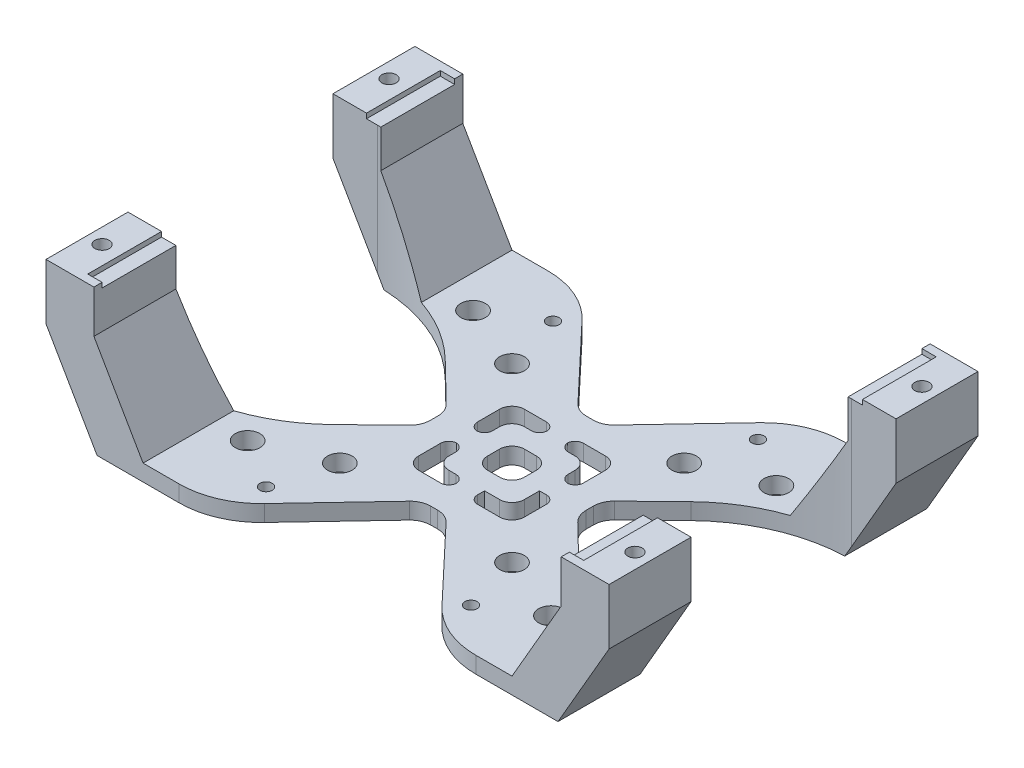
from build123d import *

# Parameters (mm, degrees)
SKETCH_1_R               = 3
SKETCH_1_R_2             = 1.5
SKETCH_1_W               = 8.959374782
SKETCH_1_H               = 8.959374782
EXTRUDE_1_DEPTH          = 4
FILLET_6_R               = 3
FILLET_7_R               = 3
FILLET_8_R               = 2
EXTRUDE_START            = -4
SKETCH_5_W               = 5
SKETCH_5_H               = 20
EXTRUDE_3_DEPTH          = 4
SKETCH_6_W               = 5
SKETCH_6_H               = 20
EXTRUDE_4_DEPTH          = 30
EXTRUDE_5_DEPTH          = 1.2
EXTRUDE_6_DEPTH          = 20
EXTRUDE_7_DEPTH          = 20
SKETCH_11_R              = 1.75
CUT_EXTRUDE_1_DEPTH      = 15
EXTRUDE_START_2          = -90
EXTRUDE_9_DEPTH          = 90
CUT_EXTRUDE_2_DEPTH      = 119.561322103
CUT_EXTRUDE_2_DEPTH_BACK = 119.561322103
CUT_EXTRUDE_4_DEPTH      = 88.841830006
CUT_EXTRUDE_4_DEPTH_BACK = 88.841830006


with BuildPart() as part:
    # Эскиз1 → Бобышка-Вытянуть1 (new body)
    with BuildSketch(Plane(origin=(0, 0, 0), x_dir=(1, 0, 0), z_dir=(0, 1, 0))):
        with BuildLine():
            ThreePointArc((20.512341433, -4.472193639), (19.393575528, -2.833865794), (19, -0.889424079))
            Line((19, -0.889424079), (19, 0.889424079))
            ThreePointArc((19, 0.889424079), (19.393575528, 2.833865794), (20.512341433, 4.472193639))
            Line((20.512341433, 4.472193639), (40.487658567, 23.91723044))
            ThreePointArc((40.487658567, 23.91723044), (41.971578686, 28.032358305), (39.6499947, 31.73999152))
            Line((39.6499947, 31.73999152), (27.6499947, 39.23999152))
            ThreePointArc((27.6499947, 39.23999152), (24.364097834, 39.959397991), (21.366001739, 38.434247609))
            Line((21.366001739, 38.434247609), (4.479687391, 20.565752391))
            ThreePointArc((4.479687391, 20.565752391), (2.824168591, 19.408092006), (0.84568913, 19))
            Line((0.84568913, 19), (-0.84568913, 19))
            ThreePointArc((-0.84568913, 19), (-2.824168591, 19.408092006), (-4.479687391, 20.565752391))
            Line((-4.479687391, 20.565752391), (-21.366001739, 38.434247609))
            ThreePointArc((-21.366001739, 38.434247609), (-24.364097834, 39.959397991), (-27.6499947, 39.23999152))
            Line((-27.6499947, 39.23999152), (-39.6499947, 31.73999152))
            ThreePointArc((-39.6499947, 31.73999152), (-41.971578686, 28.032358305), (-40.487658567, 23.91723044))
            Line((-40.487658567, 23.91723044), (-20.512341433, 4.472193639))
            ThreePointArc((-20.512341433, 4.472193639), (-19.393575528, 2.833865794), (-19, 0.889424079))
            Line((-19, 0.889424079), (-19, -0.889424079))
            ThreePointArc((-19, -0.889424079), (-19.393575528, -2.833865794), (-20.512341433, -4.472193639))
            Line((-20.512341433, -4.472193639), (-40.487658567, -23.91723044))
            ThreePointArc((-40.487658567, -23.91723044), (-41.971578686, -28.032358305), (-39.6499947, -31.73999152))
            Line((-39.6499947, -31.73999152), (-27.6499947, -39.23999152))
            ThreePointArc((-27.6499947, -39.23999152), (-24.364097834, -39.959397991), (-21.366001739, -38.434247609))
            Line((-21.366001739, -38.434247609), (-4.479687391, -20.565752391))
            ThreePointArc((-4.479687391, -20.565752391), (-2.824168591, -19.408092006), (-0.84568913, -19))
            Line((-0.84568913, -19), (0.84568913, -19))
            ThreePointArc((0.84568913, -19), (2.824168591, -19.408092006), (4.479687391, -20.565752391))
            Line((4.479687391, -20.565752391), (21.366001739, -38.434247609))
            ThreePointArc((21.366001739, -38.434247609), (24.364097834, -39.959397991), (27.6499947, -39.23999152))
            Line((27.6499947, -39.23999152), (39.6499947, -31.73999152))
            ThreePointArc((39.6499947, -31.73999152), (41.971578686, -28.032358305), (40.487658567, -23.91723044))
            Line((40.487658567, -23.91723044), (20.512341433, -4.472193639))
        make_face()
        Polygon((-12.905970183, 12.905970183), (-2.5, 12.905970183), (-2.5, 9.203534757), (-9.203534757, 9.203534757), (-9.203534757, 2.5), (-12.905970183, 2.5), align=None, mode=Mode.SUBTRACT)
        Polygon((-9.203534757, -2.5), (-9.203534757, -9.203534757), (-2.5, -9.203534757), (-2.5, -12.905970183), (-12.905970183, -12.905970183), (-12.905970183, -2.5), align=None, mode=Mode.SUBTRACT)
        Polygon((2.5, -9.203534757), (9.203534757, -9.203534757), (9.203534757, -2.5), (12.905970183, -2.5), (12.905970183, -12.905970183), (2.5, -12.905970183), align=None, mode=Mode.SUBTRACT)
        Polygon((9.203534757, 2.5), (9.203534757, 9.203534757), (2.5, 9.203534757), (2.5, 12.905970183), (12.905970183, 12.905970183), (12.905970183, 2.5), align=None, mode=Mode.SUBTRACT)
        with Locations(Location((37, -27.5, 0), (0, 0, 270))):
            Circle(SKETCH_1_R, mode=Mode.SUBTRACT)
        with Locations(Location((37, 27.5, 0), (0, 0, 270))):
            Circle(SKETCH_1_R, mode=Mode.SUBTRACT)
        with Locations(Location((25, -35, 0), (0, 0, 270))):
            Circle(SKETCH_1_R_2, mode=Mode.SUBTRACT)
        with Locations(Location((25, 35, 0), (0, 0, 270))):
            Circle(SKETCH_1_R_2, mode=Mode.SUBTRACT)
        with Locations(Location((-25, -35, 0), (0, 0, 270))):
            Circle(SKETCH_1_R_2, mode=Mode.SUBTRACT)
        with Locations(Location((-25, 35, 0), (0, 0, 270))):
            Circle(SKETCH_1_R_2, mode=Mode.SUBTRACT)
        with Locations(Location((-37, -27.5, 0), (0, 0, 270))):
            Circle(SKETCH_1_R, mode=Mode.SUBTRACT)
        with Locations(Location((-37, 27.5, 0), (0, 0, 270))):
            Circle(SKETCH_1_R, mode=Mode.SUBTRACT)
        Rectangle(SKETCH_1_W, SKETCH_1_H, mode=Mode.SUBTRACT)
        with Locations(Location((21, 21, 0), (0, 0, 270))):
            Circle(SKETCH_1_R, mode=Mode.SUBTRACT)
        with Locations(Location((21, -21, 0), (0, 0, 270))):
            Circle(SKETCH_1_R, mode=Mode.SUBTRACT)
        with Locations(Location((-21, -21, 0), (0, 0, 270))):
            Circle(SKETCH_1_R, mode=Mode.SUBTRACT)
        with Locations(Location((-21, 21, 0), (0, 0, 270))):
            Circle(SKETCH_1_R, mode=Mode.SUBTRACT)
    extrude(amount=EXTRUDE_1_DEPTH)

    # Скругление6
    fillet_6_edges = [part.edges().sort_by_distance(p)[0] for p in [
        (4.479687391, 2, 4.479687391),
        (4.479687391, 2, -4.479687391),
        (-4.479687391, 2, -4.479687391),
        (-4.479687391, 2, 4.479687391),
    ]]
    fillet(fillet_6_edges, radius=FILLET_6_R)

    # Скругление7
    fillet_7_edges = [part.edges().sort_by_distance(p)[0] for p in [
        (12.905970183, 2, -12.905970183),
        (-12.905970183, 2, -12.905970183),
        (-12.905970183, 2, 12.905970183),
        (12.905970183, 2, 12.905970183),
        (-9.203534757, 2, -9.203534757),
        (-9.203534757, 2, 9.203534757),
        (9.203534757, 2, 9.203534757),
        (9.203534757, 2, -9.203534757),
    ]]
    fillet(fillet_7_edges, radius=FILLET_7_R)

    # Скругление8
    # the kernel refuses this fillet: 2 mm, written as the material it adds along each edge
    with BuildSketch(Plane(origin=(-2.5, 0, 12.905970183), x_dir=(0, 0, -1), z_dir=(0, 1, 0)), Plane(origin=(-2.5, 0, 9.203534757), x_dir=(-1, 0, 0), z_dir=(0, 1, 0)), Plane(origin=(12.905970183, 0, 2.5), x_dir=(-1, 0, 0), z_dir=(0, 1, 0)), Plane(origin=(2.5, 0, -9.203534757), x_dir=(1, 0, 0), z_dir=(0, 1, 0)), Plane(origin=(2.5, 0, -12.905970183), x_dir=(0, 0, 1), z_dir=(0, 1, 0)), Plane(origin=(-2.5, 0, -12.905970183), x_dir=(-1, 0, 0), z_dir=(0, 1, 0)), Plane(origin=(-2.5, 0, -9.203534757), x_dir=(0, 0, -1), z_dir=(0, 1, 0))) as fillet_8_piece_1:
        with BuildLine():
            CenterArc((FILLET_8_R, FILLET_8_R), FILLET_8_R, 180, 90)
            Line((0, FILLET_8_R), (0, 0))
            Line((0, 0), (FILLET_8_R, 0))
        make_face()
    extrude(amount=4)
    with BuildSketch(Plane(origin=(12.905970183, 0, -2.5), x_dir=(-1, 0, 0), z_dir=(0, 1, 0)), Plane(origin=(2.5, 0, 12.905970183), x_dir=(0, 0, -1), z_dir=(0, 1, 0)), Plane(origin=(9.203534757, 0, -2.5), x_dir=(0, 0, -1), z_dir=(0, 1, 0)), Plane(origin=(-9.203534757, 0, -2.5), x_dir=(-1, 0, 0), z_dir=(0, 1, 0)), Plane(origin=(-12.905970183, 0, -2.5), x_dir=(0, 0, -1), z_dir=(0, 1, 0)), Plane(origin=(-9.203534757, 0, 2.5), x_dir=(0, 0, 1), z_dir=(0, 1, 0)), Plane(origin=(-12.905970183, 0, 2.5), x_dir=(1, 0, 0), z_dir=(0, 1, 0))) as fillet_8_piece_2:
        with BuildLine():
            CenterArc((FILLET_8_R, -FILLET_8_R), FILLET_8_R, 90, 90)
            Line((0, -FILLET_8_R), (0, 0))
            Line((0, 0), (FILLET_8_R, 0))
        make_face()
    extrude(amount=4)

    # Эскиз5 → Бобышка-Вытянуть3 (add)
    with BuildSketch(Plane(origin=(0, 4, 0), x_dir=(1, 0, 0), z_dir=(0, 1, 0)).offset(EXTRUDE_START)):
        with BuildLine():
            ThreePointArc((-27.6499947, 39.23999152), (-24.364097834, 39.959397991), (-21.366001739, 38.434247609))
            Line((-21.366001739, 38.434247609), (-21.652103645, 38.736990435))
            ThreePointArc((-21.652103645, 38.736990435), (-28.274178845, 43.367631975), (-36.188096689, 45))
            Line((-36.188096689, 45), (-60, 45))
            Line((-60, 45), (-60, 25))
            Line((-60, 25), (-57.854189798, 25))
            ThreePointArc((-57.854189798, 25), (-42.795741324, 22.057295227), (-29.952921259, 13.662156477))
            Line((-29.952921259, 13.662156477), (-40.487658567, 23.91723044))
            ThreePointArc((-40.487658567, 23.91723044), (-41.971578686, 28.032358305), (-39.6499947, 31.73999152))
            Line((-39.6499947, 31.73999152), (-27.6499947, 39.23999152))
        make_face()
        with Locations((-62.5, 35)):
            Rectangle(SKETCH_5_W, SKETCH_5_H)
        with BuildLine():
            Line((-21.652103645, -38.736990435), (-21.366001739, -38.434247609))
            ThreePointArc((-21.366001739, -38.434247609), (-24.364097834, -39.959397991), (-27.6499947, -39.23999152))
            Line((-27.6499947, -39.23999152), (-39.6499947, -31.73999152))
            ThreePointArc((-39.6499947, -31.73999152), (-41.971578686, -28.032358305), (-40.487658567, -23.91723044))
            Line((-40.487658567, -23.91723044), (-29.952921259, -13.662156477))
            ThreePointArc((-29.952921259, -13.662156477), (-42.795741324, -22.057295227), (-57.854189798, -25))
            Line((-57.854189798, -25), (-60, -25))
            Line((-60, -25), (-60, -45))
            Line((-60, -45), (-36.188096689, -45))
            ThreePointArc((-36.188096689, -45), (-28.274178845, -43.367631975), (-21.652103645, -38.736990435))
        make_face()
        with Locations((-62.5, -35)):
            Rectangle(SKETCH_5_W, SKETCH_5_H)
        with BuildLine():
            ThreePointArc((57.854189798, -25), (42.795741324, -22.057295227), (29.952921259, -13.662156477))
            Line((29.952921259, -13.662156477), (40.487658567, -23.91723044))
            ThreePointArc((40.487658567, -23.91723044), (41.971578686, -28.032358305), (39.6499947, -31.73999152))
            Line((39.6499947, -31.73999152), (27.6499947, -39.23999152))
            ThreePointArc((27.6499947, -39.23999152), (24.364097834, -39.959397991), (21.366001739, -38.434247609))
            Line((21.366001739, -38.434247609), (21.652103645, -38.736990435))
            ThreePointArc((21.652103645, -38.736990435), (28.274178845, -43.367631975), (36.188096689, -45))
            Line((36.188096689, -45), (60, -45))
            Line((60, -45), (60, -25))
            Line((60, -25), (57.854189798, -25))
        make_face()
        with Locations((62.5, -35)):
            Rectangle(SKETCH_5_W, SKETCH_5_H)
        with BuildLine():
            ThreePointArc((29.952921259, 13.662156477), (42.795741324, 22.057295227), (57.854189798, 25))
            Line((57.854189798, 25), (60, 25))
            Line((60, 25), (60, 45))
            Line((60, 45), (36.188096689, 45))
            ThreePointArc((36.188096689, 45), (28.274178845, 43.367631975), (21.652103645, 38.736990435))
            Line((21.652103645, 38.736990435), (21.366001739, 38.434247609))
            ThreePointArc((21.366001739, 38.434247609), (24.364097834, 39.959397991), (27.6499947, 39.23999152))
            Line((27.6499947, 39.23999152), (39.6499947, 31.73999152))
            ThreePointArc((39.6499947, 31.73999152), (41.971578686, 28.032358305), (40.487658567, 23.91723044))
            Line((40.487658567, 23.91723044), (29.952921259, 13.662156477))
        make_face()
        with Locations((62.5, 35)):
            Rectangle(SKETCH_5_W, SKETCH_5_H)
    extrude(amount=EXTRUDE_3_DEPTH)

    # Эскиз6 → Бобышка-Вытянуть4 (add)
    with BuildSketch(Plane(origin=(0, 4, 0), x_dir=(1, 0, 0), z_dir=(0, 1, 0))):
        with BuildLine():
            Line((-57, -45), (-57, -24.990878457))
            ThreePointArc((-57, -24.990878457), (-57.427070548, -24.997719549), (-57.854189798, -25))
            Line((-57.854189798, -25), (-65, -25))
            Line((-65, -25), (-65, -45))
            Line((-65, -45), (-57, -45))
        make_face()
        with BuildLine():
            Line((-57, 24.990878457), (-57, 45))
            Line((-57, 45), (-65, 45))
            Line((-65, 45), (-65, 25))
            Line((-65, 25), (-57.854189798, 25))
            ThreePointArc((-57.854189798, 25), (-57.427070548, 24.997719549), (-57, 24.990878457))
        make_face()
        with Locations((62.5, 35)):
            Rectangle(SKETCH_6_W, SKETCH_6_H)
        with BuildLine():
            Line((60, 25), (60, 45))
            Line((60, 45), (57, 45))
            Line((57, 45), (57, 24.990878457))
            ThreePointArc((57, 24.990878457), (57.427070548, 24.997719549), (57.854189798, 25))
            Line((57.854189798, 25), (60, 25))
        make_face()
        with BuildLine():
            ThreePointArc((57.854189798, -25), (57.427070548, -24.997719549), (57, -24.990878457))
            Line((57, -24.990878457), (57, -45))
            Line((57, -45), (65, -45))
            Line((65, -45), (65, -25))
            Line((65, -25), (57.854189798, -25))
        make_face()
    extrude(amount=EXTRUDE_4_DEPTH)

    # Эскиз7 → Бобышка-Вытянуть5 (add)
    with BuildSketch(Plane(origin=(0, 34, 0), x_dir=(1, 0, 0), z_dir=(0, 1, 0))):
        Polygon((-65, 25), (-60.5, 25), (-60.5, 43), (-57, 43), (-57, 45), (-65, 45), align=None)
        Polygon((-57, -43), (-60.5, -43), (-60.5, -25), (-65, -25), (-65, -45), (-57, -45), align=None)
        Polygon((60.5, -43), (57, -43), (57, -45), (65, -45), (65, -25), (60.5, -25), align=None)
        Polygon((60.5, 43), (60.5, 25), (65, 25), (65, 45), (57, 45), (57, 43), align=None)
    extrude(amount=EXTRUDE_5_DEPTH)

    # Эскиз8 → Бобышка-Вытянуть6 (add)
    with BuildSketch(Plane(origin=(0, 0, 25), x_dir=(-1, 0, 0), z_dir=(0, 0, -1))):
        Polygon((65, 35.2), (65, 15.2), (68.68585807, 21.584093447), (68.68585807, 35.2), align=None)
    extrude_6 = extrude(amount=-EXTRUDE_6_DEPTH)

    # Зеркальное отражение1: Бобышка-Вытянуть6 across plane
    add(extrude_6.mirror(Plane(origin=(0, 0, 0), x_dir=(0, 0, 1), z_dir=(1, 0, 0))))

    # Эскиз10 → Бобышка-Вытянуть7 (add)
    with BuildSketch(Plane(origin=(0, 0, -45), x_dir=(-1, 0, 0), z_dir=(0, 0, -1))):
        Polygon((65, 35.2), (65, 15.2), (68.68585807, 21.584093447), (68.68585807, 35.2), align=None)
    extrude_7 = extrude(amount=-EXTRUDE_7_DEPTH)

    # Зеркальное отражение12: Бобышка-Вытянуть7 across plane
    add(extrude_7.mirror(Plane(origin=(0, 0, 0), x_dir=(0, 0, 1), z_dir=(1, 0, 0))))

    # Эскиз11 → Вырез-Вытянуть1 (cut)
    with BuildSketch(Plane(origin=(0, 35.2, 0), x_dir=(1, 0, 0), z_dir=(0, 1, 0))):
        with Locations(Location((65, 35, 0), (0, 0, 270))):
            Circle(SKETCH_11_R)
        with Locations(Location((-65, 35, 0), (0, 0, 270))):
            Circle(SKETCH_11_R)
        with Locations(Location((-65, -35, 0), (0, 0, 270))):
            Circle(SKETCH_11_R)
        with Locations(Location((65, -35, 0), (0, 0, 270))):
            Circle(SKETCH_11_R)
    extrude(amount=-CUT_EXTRUDE_1_DEPTH, mode=Mode.SUBTRACT)

    # Эскиз13 → Бобышка-Вытянуть9 (add)
    with BuildSketch(Plane(origin=(0, 0, -45), x_dir=(-1, 0, 0), z_dir=(0, 0, -1)).offset(EXTRUDE_START_2)):
        Polygon((-57, 24.784609691), (-57, 4), (-45, 4), align=None)
        Polygon((57, 24.784609691), (45, 4), (57, 4), align=None)
    extrude(amount=EXTRUDE_9_DEPTH)

    # Эскиз14 → Вырез-Вытянуть2 (cut, two sides: drawn at the far end of the back side and taken through both)
    with BuildSketch(Plane(origin=(0, 0, -45), x_dir=(-1, 0, 0), z_dir=(0, 0, -1)).offset(-CUT_EXTRUDE_2_DEPTH_BACK)):
        Polygon((65, 15.2), (56.224275908, 0), (65, 0), align=None)
        Polygon((-56.224275908, 0), (-65, 15.2), (-65, 0), align=None)
    extrude(amount=CUT_EXTRUDE_2_DEPTH + CUT_EXTRUDE_2_DEPTH_BACK, mode=Mode.SUBTRACT)

    # Эскиз15 → Вырез-Вытянуть4 (cut, two sides: drawn at the far end of the back side and taken through both)
    with BuildSketch(Plane(origin=(0, 4, 0), x_dir=(1, 0, 0), z_dir=(0, 1, 0)).offset(-CUT_EXTRUDE_4_DEPTH_BACK)):
        with BuildLine():
            Line((-57.854189798, 25), (-68.68585807, 25))
            Line((-68.68585807, 25), (-68.68585807, -25))
            Line((-68.68585807, -25), (-57.854189798, -25))
            ThreePointArc((-57.854189798, -25), (-57.039063587, -24.991693753), (-56.224275908, -24.966778463))
            ThreePointArc((-56.224275908, -24.966778463), (-42.043708987, -21.74273665), (-29.952921259, -13.662156477))
            Line((-29.952921259, -13.662156477), (-20.512341433, -4.472193639))
            ThreePointArc((-20.512341433, -4.472193639), (-19.393575528, -2.833865794), (-19, -0.889424079))
            Line((-19, -0.889424079), (-19, 0.889424079))
            ThreePointArc((-19, 0.889424079), (-19.393575528, 2.833865794), (-20.512341433, 4.472193639))
            Line((-20.512341433, 4.472193639), (-29.952921259, 13.662156477))
            ThreePointArc((-29.952921259, 13.662156477), (-42.795741324, 22.057295227), (-57.854189798, 25))
        make_face()
        with BuildLine():
            ThreePointArc((57.854189798, 25), (42.795741324, 22.057295227), (29.952921259, 13.662156477))
            Line((29.952921259, 13.662156477), (20.512341433, 4.472193639))
            ThreePointArc((20.512341433, 4.472193639), (19.393575528, 2.833865794), (19, 0.889424079))
            Line((19, 0.889424079), (19, -0.889424079))
            ThreePointArc((19, -0.889424079), (19.393575528, -2.833865794), (20.512341433, -4.472193639))
            Line((20.512341433, -4.472193639), (29.952921259, -13.662156477))
            ThreePointArc((29.952921259, -13.662156477), (42.795741324, -22.057295227), (57.854189798, -25))
            Line((57.854189798, -25), (68.68585807, -25))
            Line((68.68585807, -25), (68.68585807, 25))
            Line((68.68585807, 25), (57.854189798, 25))
        make_face()
    extrude(amount=CUT_EXTRUDE_4_DEPTH + CUT_EXTRUDE_4_DEPTH_BACK, mode=Mode.SUBTRACT)


solid = part.part
